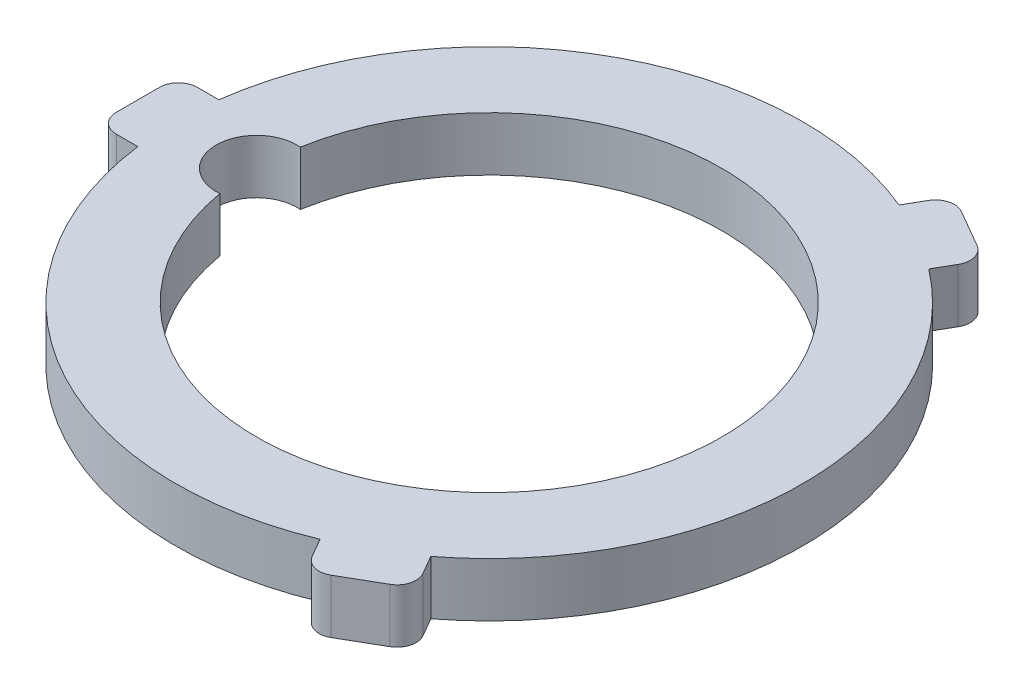
from build123d import *

# Parameters (mm, degrees)
SKIZZE1_R                       = 5.8
AUFSATZ_LINEAR_AUSTRAGEN1_DEPTH = 1
SKIZZE1_3_W                     = 1.261937381
SKIZZE1_3_H                     = 1.5
AUFSATZ_LINEAR_AUSTRAGEN2_DEPTH = 1
SKIZZE4_R                       = 4.304974062
SCHNITT_LINEAR_AUSTRAGEN1_DEPTH = 1
SKIZZE5_R                       = 0.747652737
SCHNITT_LINEAR_AUSTRAGEN2_DEPTH = 1
KREISMUSTER1_COUNT              = 3
VERRUNDUNG2_R                   = 0.35


with BuildPart() as part:
    # Skizze1 → Aufsatz-Linear austragen1 (new body)
    with BuildSketch(Plane(origin=(0, 0, 0), x_dir=(1, 0, 0), z_dir=(0, 1, 0))):
        Circle(SKIZZE1_R)
    extrude(amount=AUFSATZ_LINEAR_AUSTRAGEN1_DEPTH)

    # Skizze1<3> → Aufsatz-Linear austragen2 (add)
    with BuildSketch(Plane(origin=(0, 0, 0), x_dir=(1, 0, 0), z_dir=(0, 1, 0))):
        with Locations((-5.86903131, 0)):
            Rectangle(SKIZZE1_3_W, SKIZZE1_3_H)
    aufsatz_linear_austragen2 = extrude(amount=AUFSATZ_LINEAR_AUSTRAGEN2_DEPTH)

    # Skizze4 → Schnitt-Linear austragen1 (cut)
    with BuildSketch(Plane(origin=(0, 1, 0), x_dir=(1, 0, 0), z_dir=(0, 1, 0))):
        Circle(SKIZZE4_R)
    extrude(amount=-SCHNITT_LINEAR_AUSTRAGEN1_DEPTH, mode=Mode.SUBTRACT)

    # Skizze5 → Schnitt-Linear austragen2 (cut)
    with BuildSketch(Plane(origin=(0, 1, 0), x_dir=(1, 0, 0), z_dir=(0, 1, 0))):
        with Locations((-4.304974062, 0)):
            Circle(SKIZZE5_R)
    extrude(amount=-SCHNITT_LINEAR_AUSTRAGEN2_DEPTH, mode=Mode.SUBTRACT)

    # Kreismuster1: Aufsatz-Linear austragen2 ×3 about axis
    kreismuster1_axis = Axis((0, 0, 0), (0, 1, 0))
    for i in range(1, KREISMUSTER1_COUNT):
        add(aufsatz_linear_austragen2.rotate(kreismuster1_axis, i * 360 / KREISMUSTER1_COUNT))

    # Verrundung2
    verrundung2_edges = [part.edges().sort_by_distance(p)[0] for p in [
        (2.600480947, 0.5, 6.004165125),
        (3.899519053, 0.5, 5.254165125),
        (3.899519053, 0.5, -5.254165125),
        (2.600480947, 0.5, -6.004165125),
        (-6.5, 0.5, 0.75),
        (-6.5, 0.5, -0.75),
    ]]
    fillet(verrundung2_edges, radius=VERRUNDUNG2_R)


solid = part.part
